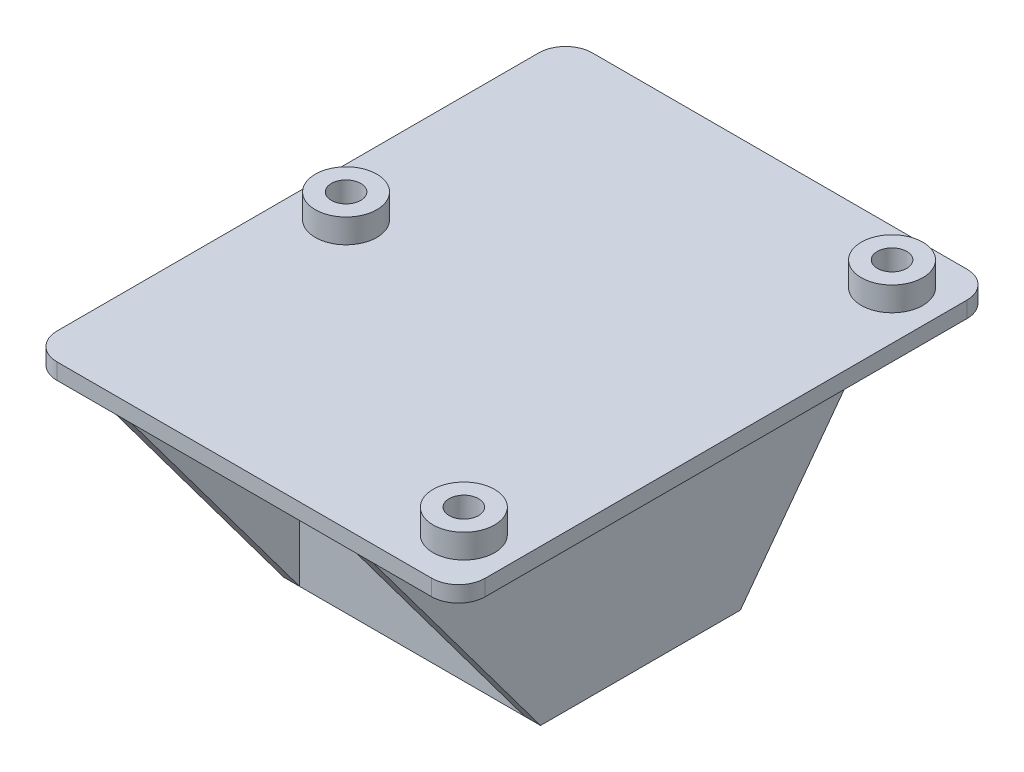
from build123d import *

# Parameters (mm, degrees)
BOSS_EXTRUDE1_DEPTH     = 3
SKETCH2_R               = 2.75
CUT_EXTRUDE1_DEPTH      = 65.101482042
BOSS_EXTRUDE3_START     = 4.5
SKETCH3_2_R             = 5.75
SKETCH3_2_R_2           = 2.75
BOSS_EXTRUDE3_DEPTH     = 4.5
BOSS_EXTRUDE2_START     = 4.5
SKETCH3_R               = 5.75
SKETCH3_R_2             = 2.75
BOSS_EXTRUDE2_DEPTH     = 4.5
SKETCH7_W               = 42
SKETCH7_H               = 31.333333334
BOSS_EXTRUDE4_DEPTH     = 42
CUT_EXTRUDE2_DEPTH      = 90.358827208
CUT_EXTRUDE2_DEPTH_BACK = 90.358827208
SKETCH9_R               = 5
SKETCH9_R_2             = 1.5
CUT_EXTRUDE3_DEPTH      = 90.883875701


with BuildPart() as part:
    # Sketch1 → Boss-Extrude1 (new body)
    with BuildSketch(Plane(origin=(0, 0, 0), x_dir=(1, 0, 0), z_dir=(0, 1, 0))):
        with BuildLine():
            Line((-35, 50), (35, 50))
            ThreePointArc((35, 50), (38.535533906, 48.535533906), (40, 45))
            Line((40, 45), (40, -45))
            ThreePointArc((40, -45), (38.535533906, -48.535533906), (35, -50))
            Line((35, -50), (-35, -50))
            ThreePointArc((-35, -50), (-38.535533906, -48.535533906), (-40, -45))
            Line((-40, -45), (-40, 45))
            ThreePointArc((-40, 45), (-38.535533906, 48.535533906), (-35, 50))
        make_face()
    extrude(amount=BOSS_EXTRUDE1_DEPTH)

    # Sketch2 → Cut-Extrude1 (cut, through all)
    with BuildSketch(Plane(origin=(0, 3, 0), x_dir=(1, 0, 0), z_dir=(0, 1, 0))):
        with Locations((-31, 0)):
            Circle(SKETCH2_R)
        with Locations((31, 40)):
            Circle(SKETCH2_R)
        with Locations((31, -40)):
            Circle(SKETCH2_R)
    extrude(amount=-CUT_EXTRUDE1_DEPTH, mode=Mode.SUBTRACT)

    # Sketch3<2> → Boss-Extrude3 (add)
    # profile 1 of 3: a face of its own
    with BuildSketch(Plane(origin=(0, 3, 0), x_dir=(1, 0, 0), z_dir=(0, 1, 0)).offset(BOSS_EXTRUDE3_START)):
        with Locations((-31, 0)):
            Circle(SKETCH3_2_R)
        with Locations((-31, 0)):
            Circle(SKETCH3_2_R_2, mode=Mode.SUBTRACT)
    # profile 2 of 3: a face of its own
    with BuildSketch(Plane(origin=(0, 3, 0), x_dir=(1, 0, 0), z_dir=(0, 1, 0)).offset(BOSS_EXTRUDE3_START)):
        with Locations((31, 40)):
            Circle(SKETCH3_2_R)
        with Locations((31, 40)):
            Circle(SKETCH3_2_R_2, mode=Mode.SUBTRACT)
    # profile 3 of 3: a face of its own
    with BuildSketch(Plane(origin=(0, 3, 0), x_dir=(1, 0, 0), z_dir=(0, 1, 0)).offset(BOSS_EXTRUDE3_START)):
        with Locations((31, -40)):
            Circle(SKETCH3_2_R)
        with Locations((31, -40)):
            Circle(SKETCH3_2_R_2, mode=Mode.SUBTRACT)
    extrude(amount=-BOSS_EXTRUDE3_DEPTH)

    # Sketch3 → Boss-Extrude2 (add)
    # profile 1 of 3: a face of its own
    with BuildSketch(Plane(origin=(0, 3, 0), x_dir=(1, 0, 0), z_dir=(0, 1, 0)).offset(BOSS_EXTRUDE2_START)):
        with Locations((-31, 0)):
            Circle(SKETCH3_R)
        with Locations((-31, 0)):
            Circle(SKETCH3_R_2, mode=Mode.SUBTRACT)
    # profile 2 of 3: a face of its own
    with BuildSketch(Plane(origin=(0, 3, 0), x_dir=(1, 0, 0), z_dir=(0, 1, 0)).offset(BOSS_EXTRUDE2_START)):
        with Locations((31, 40)):
            Circle(SKETCH3_R)
        with Locations((31, 40)):
            Circle(SKETCH3_R_2, mode=Mode.SUBTRACT)
    # profile 3 of 3: a face of its own
    with BuildSketch(Plane(origin=(0, 3, 0), x_dir=(1, 0, 0), z_dir=(0, 1, 0)).offset(BOSS_EXTRUDE2_START)):
        with Locations((31, -40)):
            Circle(SKETCH3_R)
        with Locations((31, -40)):
            Circle(SKETCH3_R_2, mode=Mode.SUBTRACT)
    extrude(amount=-BOSS_EXTRUDE2_DEPTH)

    # Sketch7 → Boss-Extrude4 (add)
    with BuildSketch(Plane.XZ):
        Polygon((21, 50), (24, 50), (24, -50), (21, -50), (21, -18.666666667), (-21, -18.666666667), (-21, -50), (-24, -50), (-24, 50), (-21, 50), (-21, 18.666666667), (21, 18.666666667), align=None)
        Rectangle(SKETCH7_W, SKETCH7_H, mode=Mode.SUBTRACT)
    extrude(amount=BOSS_EXTRUDE4_DEPTH)

    # Sketch8 → Cut-Extrude2 (cut, two sides: drawn at the far end of the back side and taken through both)
    with BuildSketch(Plane(origin=(-21, 0, 0), x_dir=(0, 0, -1), z_dir=(1, 0, 0)).offset(-CUT_EXTRUDE2_DEPTH_BACK)):
        Polygon((-50, 0), (-18.666666667, -42), (-50, -42), align=None)
        Polygon((18.666666667, -42), (50, 0), (50, -42), align=None)
    extrude(amount=CUT_EXTRUDE2_DEPTH + CUT_EXTRUDE2_DEPTH_BACK, mode=Mode.SUBTRACT)

    # Sketch9 → Cut-Extrude3 (cut, through all)
    with BuildSketch(Plane.XY.offset(18.666666667)):
        with Locations((0, -21)):
            Circle(SKETCH9_R)
        with Locations((-8.838834765, -12.161165235)):
            Circle(SKETCH9_R_2)
        with Locations((-8.838834765, -29.838834765)):
            Circle(SKETCH9_R_2)
        with Locations((8.838834765, -29.838834765)):
            Circle(SKETCH9_R_2)
        with Locations((8.838834765, -12.161165235)):
            Circle(SKETCH9_R_2)
    extrude(amount=-CUT_EXTRUDE3_DEPTH, mode=Mode.SUBTRACT)


solid = part.part
